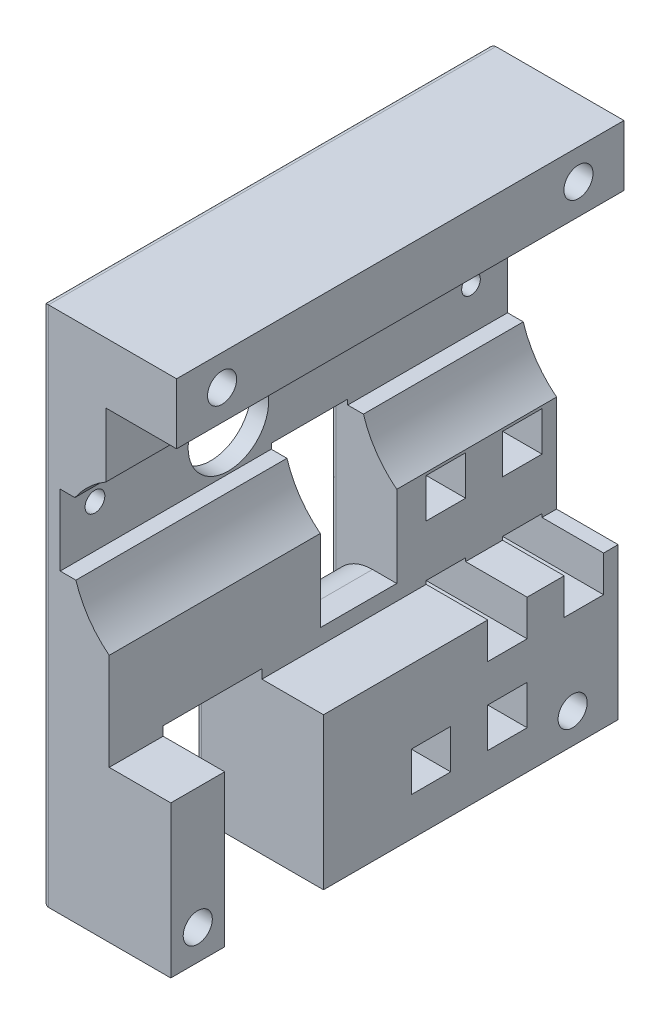
from build123d import *

# Parameters (mm, degrees)
PROFILEEXTRUDE_DEPTH    = 73.76
HOSEWINDOW_W            = 16.29
HOSEWINDOW_H            = 26.5
HOSEWINDOWCUT_DEPTH     = 95.161864378
CAGESCREWS_R            = 2.4
CAGESCREWSCUT_DEPTH     = 95.161864378
AXLEHOLECUT_DEPTH       = 95.161864378
SETSCREWHOLES_R         = 1.539432213
SETSCREWHOLES_R_2       = 1.628953018
SETSCREWHOLESCUT_DEPTH  = 95.161864456
VELOCITYWINDOW_W        = 12.61
VELOCITYWINDOW_H        = 22.29
VELOCITYWINDOWCUT_DEPTH = 95.161864456
FILLET3_R               = 7
TRIGGERRACKSLOTCUT_W    = 6.5
TRIGGERRACKSLOTCUT_H    = 6.5
RACKSLOTCUT_DEPTH       = 95.161864456
FILLET4_R               = 1


with BuildPart() as part:
    # Profile → ProfileExtrude (new body)
    with BuildSketch(Plane.XY):
        with BuildLine():
            Line((9.301269376, -54.194713793), (9.301269376, -29.194713793))
            Line((9.301269376, -29.194713793), (-0.848730624, -29.194713793))
            Line((-0.848730624, -29.194713793), (-0.848730624, -13.196583793))
            ThreePointArc((-0.848730624, -13.196583793), (-4.204324299, -9.619560571), (-6.340730624, -5.204713793))
            Line((-6.340730624, -5.204713793), (-8.928730624, -5.204713793))
            Line((-8.928730624, -5.204713793), (-8.928730624, 6.495286207))
            Line((-8.928730624, 6.495286207), (-6.509650624, 6.495286207))
            ThreePointArc((-6.509650624, 6.495286207), (-4.210311879, 9.168674207), (-1.388730624, 11.283536207))
            Line((-1.388730624, 11.283536207), (-1.388730624, 21.845286207))
            Line((-1.388730624, 21.845286207), (10.261269376, 21.845286207))
            Line((10.261269376, 21.845286207), (10.261269376, 31.845286207))
            Line((10.261269376, 31.845286207), (-11.848730624, 31.845286207))
            Line((-11.848730624, 31.845286207), (-11.848730624, -54.194713793))
            Line((-11.848730624, -54.194713793), (9.301269376, -54.194713793))
        make_face()
    extrude(amount=PROFILEEXTRUDE_DEPTH)

    # HoseWindow → HoseWindowCut (cut, through all)
    with BuildSketch(Plane.ZY.offset(11.848730624)):
        with Locations((56.725, -40.944713793)):
            Rectangle(HOSEWINDOW_W, HOSEWINDOW_H)
    extrude(amount=-HOSEWINDOWCUT_DEPTH, mode=Mode.SUBTRACT)

    # CageScrews → CageScrewsCut (cut, through all)
    with BuildSketch(Plane.ZY.offset(11.848730624)):
        with Locations((7.5, 26.845286207)):
            Circle(CAGESCREWS_R)
        with Locations((66.26, 26.845286207)):
            Circle(CAGESCREWS_R)
        with Locations((7.5, -49.194713793)):
            Circle(CAGESCREWS_R)
        with Locations((69.31, -49.194713793)):
            Circle(CAGESCREWS_R)
    extrude(amount=-CAGESCREWSCUT_DEPTH, mode=Mode.SUBTRACT)

    # AxleHole → AxleHoleCut (cut, through all)
    with BuildSketch(Plane.ZY.offset(11.848730624)):
        with BuildLine():
            Line((47.361, 8.359497151), (47.361, 6.740497151))
            Line((47.361, 6.740497151), (44.699, 6.740497151))
            Line((44.699, 6.740497151), (44.699, 8.359497151))
            ThreePointArc((44.699, 8.359497151), (46.03, -4.783713793), (47.361, 8.359497151))
        make_face()
    extrude(amount=-AXLEHOLECUT_DEPTH, mode=Mode.SUBTRACT)

    # SetScrewHoles → SetScrewHolesCut (cut, through all)
    with BuildSketch(Plane.ZY.offset(11.848730624)):
        with Locations((6.03, 1.855286207)):
            Circle(SETSCREWHOLES_R)
        with Locations((68.03, 1.855286207)):
            Circle(SETSCREWHOLES_R_2)
    extrude(amount=-SETSCREWHOLESCUT_DEPTH, mode=Mode.SUBTRACT)

    # VelocityWindow → VelocityWindowCut (cut, through all)
    with BuildSketch(Plane.ZY.offset(11.848730624)):
        with Locations((32.655, -15.499713793)):
            Rectangle(VELOCITYWINDOW_W, VELOCITYWINDOW_H)
    extrude(amount=-VELOCITYWINDOWCUT_DEPTH, mode=Mode.SUBTRACT)

    # Fillet3
    fillet3_edges = [part.edges().sort_by_distance(p)[0] for p in [
        (-11.848730624, -26.644713793, 32.655),
    ]]
    fillet(fillet3_edges, radius=FILLET3_R)

    # TriggerRackSlotCut → RackSlotCut (cut, through all)
    with BuildSketch(Plane.ZY.offset(11.848730624)):
        with Locations((18.25, -44.594713793)):
            Rectangle(TRIGGERRACKSLOTCUT_W, TRIGGERRACKSLOTCUT_H)
        with Locations((30.85, -44.594713793)):
            Rectangle(TRIGGERRACKSLOTCUT_W, TRIGGERRACKSLOTCUT_H)
        with Locations((5.65, -31.894713793)):
            Rectangle(TRIGGERRACKSLOTCUT_W, TRIGGERRACKSLOTCUT_H)
        with Locations((18.25, -31.894713793)):
            Rectangle(TRIGGERRACKSLOTCUT_W, TRIGGERRACKSLOTCUT_H)
        with Locations((5.65, -16.894713793)):
            Rectangle(TRIGGERRACKSLOTCUT_W, TRIGGERRACKSLOTCUT_H)
        with Locations((18.25, -16.894713793)):
            Rectangle(TRIGGERRACKSLOTCUT_W, TRIGGERRACKSLOTCUT_H)
    extrude(amount=-RACKSLOTCUT_DEPTH, mode=Mode.SUBTRACT)

    # Fillet4
    fillet4_edges = [part.edges().sort_by_distance(p)[0] for p in [
        (-11.848730624, -31.894713793, 21.5),
        (-11.848730624, -28.644713793, 18.25),
        (-11.848730624, -31.894713793, 15),
        (-11.848730624, -35.144713793, 18.25),
        (-11.848730624, -47.844713793, 18.25),
        (-11.848730624, -44.594713793, 15),
        (-11.848730624, -41.344713793, 18.25),
        (-11.848730624, -44.594713793, 21.5),
        (-11.848730624, -47.844713793, 30.85),
        (-11.848730624, -44.594713793, 34.1),
        (-11.848730624, -18.999713793, 38.96),
        (-11.848730624, -4.354713793, 32.655),
        (-11.848730624, -18.999713793, 26.35),
        (-11.848730624, -11.174713793, 0),
        (-11.848730624, -54.194713793, 24.29),
        (-11.848730624, -40.944713793, 48.58),
        (-11.848730624, -27.694713793, 56.725),
        (-11.848730624, -40.944713793, 64.87),
        (-11.848730624, -54.194713793, 69.315),
        (-11.848730624, -11.174713793, 73.76),
        (-11.848730624, 31.845286207, 36.88),
        (-11.848730624, -44.594713793, 27.6),
        (-11.848730624, -41.344713793, 30.85),
        (-11.848730624, -35.144713793, 5.65),
        (-11.848730624, -31.894713793, 2.4),
        (-11.848730624, -31.894713793, 8.9),
        (-11.848730624, -28.644713793, 5.65),
        (-11.848730624, -13.644713793, 18.25),
        (-11.848730624, -16.894713793, 21.5),
        (-11.848730624, -20.144713793, 18.25),
        (-11.848730624, -16.894713793, 15),
        (-11.848730624, -16.894713793, 2.4),
        (-11.848730624, -20.144713793, 5.65),
        (-11.848730624, -16.894713793, 8.9),
        (-11.848730624, -13.644713793, 5.65),
    ]]
    fillet(fillet4_edges, radius=FILLET4_R)


solid = part.part
